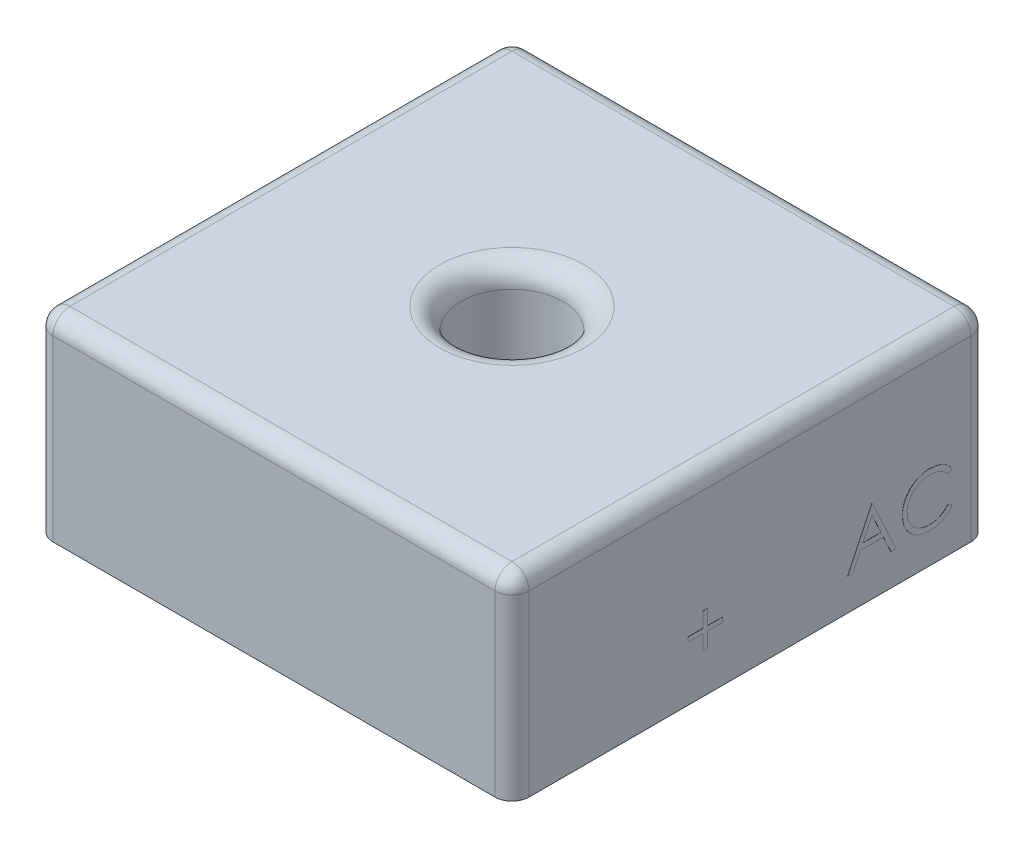
from build123d import *

# Parameters (mm, degrees)
SKETCH1_W                     = 28
SKETCH1_H                     = 28
SKETCH1_R                     = 3
BOSS_EXTRUDE1_DEPTH           = 11.5
FILLET1_R                     = 1.25
SKETCH2_W                     = 25.8
SKETCH2_H                     = 25.8
SKETCH2_R                     = 4
CUT_EXTRUDE1_DEPTH            = 2.5
SKETCH3_R                     = 0.7
BOSS_EXTRUDE2_DEPTH           = 6.5
SKETCH4_R                     = 0.7
BOSS_EXTRUDE3_DEPTH           = 0.5
BOSS_EXTRUDE3_DRAFT           = 20
BOSS_EXTRUDE3_PROFILE_2_DEPTH = 0.5
BOSS_EXTRUDE3_PROFILE_2_DRAFT = 20
BOSS_EXTRUDE3_PROFILE_3_DEPTH = 0.5
BOSS_EXTRUDE3_PROFILE_3_DRAFT = 20
BOSS_EXTRUDE3_PROFILE_4_DEPTH = 0.5
BOSS_EXTRUDE3_PROFILE_4_DRAFT = 20
FILLET2_SIZE                  = 2.2
FILLET3_R                     = 1
BOSS_EXTRUDE4_DEPTH           = 0.01


with BuildPart() as part:
    # Sketch1 → Boss-Extrude1 (new body)
    with BuildSketch(Plane(origin=(0, 0, 0), x_dir=(1, 0, 0), z_dir=(0, 1, 0))):
        Rectangle(SKETCH1_W, SKETCH1_H)
        with Locations(Location((0, 0, 0), (0, 0, 270))):
            Circle(SKETCH1_R, mode=Mode.SUBTRACT)
    extrude(amount=BOSS_EXTRUDE1_DEPTH)

    # Fillet1
    fillet1_edges = [part.edges().sort_by_distance(p)[0] for p in [
        (0, 11.5, -3),
    ]]
    fillet(fillet1_edges, radius=FILLET1_R)

    # Sketch2 → Cut-Extrude1 (cut)
    with BuildSketch(Plane.XZ):
        Rectangle(SKETCH2_W, SKETCH2_H)
        with Locations(Location((0, 0, 0), (0, 0, 270))):
            Circle(SKETCH2_R, mode=Mode.SUBTRACT)
    extrude(amount=-CUT_EXTRUDE1_DEPTH, mode=Mode.SUBTRACT)

    # Sketch3 → Boss-Extrude2 (add)
    with BuildSketch(Plane(origin=(0, 2.5, 0), x_dir=(-1, 0, 0), z_dir=(0, -1, 0))):
        with Locations(Location((-8.9, -2.1, 0), (0, 0, 270))):
            Circle(SKETCH3_R)
        with Locations(Location((-8.9, 8.9, 0), (0, 0, 270))):
            Circle(SKETCH3_R)
        with Locations(Location((8.9, 8.9, 0), (0, 0, 270))):
            Circle(SKETCH3_R)
        with Locations(Location((8.9, -8.9, 0), (0, 0, 270))):
            Circle(SKETCH3_R)
    extrude(amount=BOSS_EXTRUDE2_DEPTH)


with BuildPart() as boss_extrude3_tool:
    # Sketch4 → Boss-Extrude3 (with draft: the straight prism first)
    with BuildSketch(Plane(origin=(0, -4, 0), x_dir=(-1, 0, 0), z_dir=(0, -1, 0))):
        with Locations(Location((8.9, -8.9, 0), (0, 0, 270))):
            Circle(SKETCH4_R)
    extrude(amount=BOSS_EXTRUDE3_DEPTH)
    # Boss-Extrude3: the draft: its side faces are tilted about the plane it starts from
    boss_extrude3_sides = [boss_extrude3_tool.faces().sort_by_distance(p)[0] for p in [
        (-8.9, -4.25, 8.2),
    ]]
    draft(boss_extrude3_sides, Plane(origin=(0, -4, 0), x_dir=(-1, 0, 0), z_dir=(0, -1, 0)), BOSS_EXTRUDE3_DRAFT)


with BuildPart() as part_1:
    add(part.part)

    # Boss-Extrude3: add boss_extrude3_tool
    add(boss_extrude3_tool.part)


with BuildPart() as boss_extrude3_profile_2_tool:
    # Sketch4 → Boss-Extrude3 profile 2 (with draft: the straight prism first)
    with BuildSketch(Plane(origin=(0, -4, 0), x_dir=(-1, 0, 0), z_dir=(0, -1, 0))):
        with Locations(Location((-8.9, -2.1, 0), (0, 0, 270))):
            Circle(SKETCH4_R)
    extrude(amount=BOSS_EXTRUDE3_PROFILE_2_DEPTH)
    # Boss-Extrude3 profile 2: the draft: its side faces are tilted about the plane it starts from
    boss_extrude3_profile_2_sides = [boss_extrude3_profile_2_tool.faces().sort_by_distance(p)[0] for p in [
        (8.9, -4.25, 1.4),
    ]]
    draft(boss_extrude3_profile_2_sides, Plane(origin=(0, -4, 0), x_dir=(-1, 0, 0), z_dir=(0, -1, 0)), BOSS_EXTRUDE3_PROFILE_2_DRAFT)


with BuildPart() as part_2:
    add(part_1.part)

    # Boss-Extrude3 profile 2: add boss_extrude3_profile_2_tool
    add(boss_extrude3_profile_2_tool.part)


with BuildPart() as boss_extrude3_profile_3_tool:
    # Sketch4 → Boss-Extrude3 profile 3 (with draft: the straight prism first)
    with BuildSketch(Plane(origin=(0, -4, 0), x_dir=(-1, 0, 0), z_dir=(0, -1, 0))):
        with Locations(Location((-8.9, 8.9, 0), (0, 0, 270))):
            Circle(SKETCH4_R)
    extrude(amount=BOSS_EXTRUDE3_PROFILE_3_DEPTH)
    # Boss-Extrude3 profile 3: the draft: its side faces are tilted about the plane it starts from
    boss_extrude3_profile_3_sides = [boss_extrude3_profile_3_tool.faces().sort_by_distance(p)[0] for p in [
        (8.9, -4.25, -9.6),
    ]]
    draft(boss_extrude3_profile_3_sides, Plane(origin=(0, -4, 0), x_dir=(-1, 0, 0), z_dir=(0, -1, 0)), BOSS_EXTRUDE3_PROFILE_3_DRAFT)


with BuildPart() as part_3:
    add(part_2.part)

    # Boss-Extrude3 profile 3: add boss_extrude3_profile_3_tool
    add(boss_extrude3_profile_3_tool.part)


with BuildPart() as boss_extrude3_profile_4_tool:
    # Sketch4 → Boss-Extrude3 profile 4 (with draft: the straight prism first)
    with BuildSketch(Plane(origin=(0, -4, 0), x_dir=(-1, 0, 0), z_dir=(0, -1, 0))):
        with Locations(Location((8.9, 8.9, 0), (0, 0, 270))):
            Circle(SKETCH4_R)
    extrude(amount=BOSS_EXTRUDE3_PROFILE_4_DEPTH)
    # Boss-Extrude3 profile 4: the draft: its side faces are tilted about the plane it starts from
    boss_extrude3_profile_4_sides = [boss_extrude3_profile_4_tool.faces().sort_by_distance(p)[0] for p in [
        (-8.9, -4.25, -9.6),
    ]]
    draft(boss_extrude3_profile_4_sides, Plane(origin=(0, -4, 0), x_dir=(-1, 0, 0), z_dir=(0, -1, 0)), BOSS_EXTRUDE3_PROFILE_4_DRAFT)


with BuildPart() as part_4:
    add(part_3.part)

    # Boss-Extrude3 profile 4: add boss_extrude3_profile_4_tool
    add(boss_extrude3_profile_4_tool.part)

    # Fillet2
    # a fillet whose section is not a circle: 2.2 mm, written as the material it adds along each edge
    with BuildSketch(Plane(origin=(12.9, 2.5, -12.9), x_dir=(-1, 0, 0), z_dir=(0, 0, 1)), Plane(origin=(-12.9, 2.5, -12.9), x_dir=(0, 0, 1), z_dir=(1, 0, 0)), Plane(origin=(-12.9, 2.5, 12.9), x_dir=(1, 0, 0), z_dir=(0, 0, -1)), Plane(origin=(12.9, 2.5, 12.9), x_dir=(0, 0, -1), z_dir=(-1, 0, 0))) as fillet2_piece_1:
        with BuildLine():
            Bezier((FILLET2_SIZE, 0), (0, 0), (0, FILLET2_SIZE), weights=[1, 0.25, 1])
            Line((0, FILLET2_SIZE), (0, 0))
            Line((0, 0), (FILLET2_SIZE, 0))
        make_face()
    extrude(amount=25.8)
    with BuildSketch(Plane(origin=(0, 2.5, 0), x_dir=(0, 0, -1), z_dir=(-1, 0, 0))) as fillet2_piece_2:
        with BuildLine():
            Bezier((4, FILLET2_SIZE), (4, 0), (4 + FILLET2_SIZE, 0), weights=[1, 0.25, 1])
            Line((4 + FILLET2_SIZE, 0), (4, 0))
            Line((4, 0), (4, FILLET2_SIZE))
        make_face()
    revolve(axis=Axis((0, 2.5, 0), (0, -1, 0)))
    with BuildSketch(Plane(origin=(8.9, 2.5, 2.1), x_dir=(0, 0, 1), z_dir=(1, 0, 0))) as fillet2_piece_3:
        with BuildLine():
            Bezier((0.7 + FILLET2_SIZE, 0), (0.7, 0), (0.7, FILLET2_SIZE), weights=[1, 0.25, 1])
            Line((0.7, FILLET2_SIZE), (0.7, 0))
            Line((0.7, 0), (0.7 + FILLET2_SIZE, 0))
        make_face()
    revolve(axis=Axis((8.9, 2.5, 2.1), (0, -1, 0)))
    with BuildSketch(Plane(origin=(8.9, 2.5, -8.9), x_dir=(0, 0, 1), z_dir=(1, 0, 0))) as fillet2_piece_4:
        with BuildLine():
            Bezier((0.7 + FILLET2_SIZE, 0), (0.7, 0), (0.7, FILLET2_SIZE), weights=[1, 0.25, 1])
            Line((0.7, FILLET2_SIZE), (0.7, 0))
            Line((0.7, 0), (0.7 + FILLET2_SIZE, 0))
        make_face()
    revolve(axis=Axis((8.9, 2.5, -8.9), (0, -1, 0)))
    with BuildSketch(Plane(origin=(-8.9, 2.5, -8.9), x_dir=(0, 0, 1), z_dir=(1, 0, 0))) as fillet2_piece_5:
        with BuildLine():
            Bezier((0.7 + FILLET2_SIZE, 0), (0.7, 0), (0.7, FILLET2_SIZE), weights=[1, 0.25, 1])
            Line((0.7, FILLET2_SIZE), (0.7, 0))
            Line((0.7, 0), (0.7 + FILLET2_SIZE, 0))
        make_face()
    revolve(axis=Axis((-8.9, 2.5, -8.9), (0, -1, 0)))
    with BuildSketch(Plane(origin=(-8.9, 2.5, 8.9), x_dir=(0, 0, 1), z_dir=(1, 0, 0))) as fillet2_piece_6:
        with BuildLine():
            Bezier((0.7 + FILLET2_SIZE, 0), (0.7, 0), (0.7, FILLET2_SIZE), weights=[1, 0.25, 1])
            Line((0.7, FILLET2_SIZE), (0.7, 0))
            Line((0.7, 0), (0.7 + FILLET2_SIZE, 0))
        make_face()
    revolve(axis=Axis((-8.9, 2.5, 8.9), (0, -1, 0)))

    # Fillet3
    fillet3_edges = [part_4.edges().sort_by_distance(p)[0] for p in [
        (14, 11.5, 0),
        (0, 11.5, -14),
        (-14, 11.5, 0),
        (0, 11.5, 14),
        (-14, 5.75, -14),
        (14, 5.75, -14),
        (14, 5.75, 14),
        (-14, 5.75, 14),
    ]]
    fillet(fillet3_edges, radius=FILLET3_R)

    # Sketch5 → Boss-Extrude4 (add)
    # profile 1 of 3: a face of its own
    with BuildSketch(Plane(origin=(14, 0, 0), x_dir=(0, 0, -1), z_dir=(1, 0, 0))):
        Polygon((-2.768987679, 3.48677818), (-2.768987679, 4.371393565), (-2.49975691, 4.371393565), (-2.49975691, 3.48677818), (-1.615141525, 3.48677818), (-1.615141525, 3.217547411), (-2.49975691, 3.217547411), (-2.49975691, 2.332932026), (-2.768987679, 2.332932026), (-2.768987679, 3.217547411), (-3.653603064, 3.217547411), (-3.653603064, 3.48677818), align=None)
    # profile 2 of 3: a face of its own
    with BuildSketch(Plane(origin=(14, 0, 0), x_dir=(0, 0, -1), z_dir=(1, 0, 0))):
        Polygon((7.192550782, 4.871393565), (8.577166167, 1.871393565), (8.284497898, 1.871393565), (7.840988282, 2.832932026), (6.481012321, 2.832932026), (6.024882513, 1.871393565), (5.731012321, 1.871393565), (7.154089244, 4.871393565), align=None)
        Polygon((7.170315206, 4.286657988), (6.627045975, 3.140624334), (7.699161359, 3.140624334), align=None, mode=Mode.SUBTRACT)
    # profile 3 of 3: a face of its own
    with BuildSketch(Plane(origin=(14, 0, 0), x_dir=(0, 0, -1), z_dir=(1, 0, 0))):
        with BuildLine():
            Line((11.884858475, 4.320912796), (11.649281552, 4.140624334))
            add(Edge.make_bspline(
                [(11.649281552, 4.140624334), (11.632476505, 4.160652308), (11.599092979, 4.200438236), (11.545385091, 4.256306417), (11.489412254, 4.30864807), (11.431195864, 4.357712538), (11.369688048, 4.401784051), (11.306378792, 4.443159282), (11.240209039, 4.480245915), (11.148707552, 4.525214189), (11.029009396, 4.572139464), (10.878328106, 4.611485091), (10.721032878, 4.636531813), (10.61372065, 4.639244535), (10.559137321, 4.640624334)],
                knots=[0, 0, 0, 0, 0.757959112, 1.505699292, 2.245454638, 2.979532153, 3.711538275, 4.438200793, 5.171680507, 5.909471876, 7.393775596, 8.890124382, 10.418191784, 12, 12, 12, 12], degree=3))
            add(Edge.make_bspline(
                [(10.559137321, 4.640624334), (10.529065921, 4.64027808), (10.469202214, 4.639588787), (10.380360665, 4.630495251), (10.29317805, 4.617714214), (10.207711079, 4.598749651), (10.124068543, 4.57477312), (10.041703627, 4.546122766), (9.961808827, 4.51067576), (9.883278908, 4.471497251), (9.808039585, 4.427245156), (9.736849544, 4.378976569), (9.669968428, 4.327231629), (9.607343332, 4.271816395), (9.548910234, 4.212980429), (9.495092539, 4.150096707), (9.446076473, 4.083366273), (9.400890451, 4.013669066), (9.360422394, 3.941208102), (9.32653964, 3.865715185), (9.29653525, 3.788483096), (9.272793042, 3.708639244), (9.254000599, 3.626745445), (9.24103403, 3.542581912), (9.232043912, 3.456324473), (9.231358046, 3.397859348), (9.231012321, 3.368388757)],
                knots=[0, 0, 0, 0, 1.054917814, 2.100044995, 3.131103042, 4.146048494, 5.169673617, 6.183595914, 7.203665975, 8.234915748, 9.262203917, 10.264457458, 11.251630812, 12.227803204, 13.197192746, 14.159520551, 15.12972552, 16.100847026, 17.073214652, 18.039054194, 19.002613845, 19.979014051, 20.95965708, 21.949030935, 22.966165397, 24, 24, 24, 24], degree=3))
            add(Edge.make_bspline(
                [(9.231012321, 3.368388757), (9.23209388, 3.324047626), (9.234217378, 3.236989696), (9.25311595, 3.10947203), (9.2818346, 2.987311452), (9.324876523, 2.871271587), (9.377949995, 2.759921566), (9.445013376, 2.655145406), (9.522684694, 2.555359779), (9.612062768, 2.462922967), (9.710124896, 2.378482631), (9.815337391, 2.30412499), (9.927438209, 2.242140805), (10.045189607, 2.190561422), (10.169497704, 2.150912798), (10.300138964, 2.123000692), (10.436829245, 2.104793109), (10.530231588, 2.103049948), (10.577767129, 2.102162796)],
                knots=[0, 0, 0, 0, 1.029171465, 2.020641659, 2.987623507, 3.938342917, 4.889210282, 5.84687017, 6.821220943, 7.821438502, 8.827599549, 9.822697543, 10.807740252, 11.797342354, 12.80366471, 13.83203677, 14.896651826, 16, 16, 16, 16], degree=3))
            add(Edge.make_bspline(
                [(10.577767129, 2.102162796), (10.630140862, 2.103610321), (10.733224898, 2.106459398), (10.884397492, 2.130595897), (11.029113863, 2.169731255), (11.167381794, 2.224500903), (11.298811491, 2.295699721), (11.423608628, 2.382012187), (11.541878546, 2.48425933), (11.612996788, 2.562330582), (11.649281552, 2.602162796)],
                knots=[0, 0, 0, 0, 1.028121516, 2.023589091, 2.998037872, 3.967518031, 4.937445131, 5.927275754, 6.942489185, 8, 8, 8, 8], degree=3))
            Line((11.649281552, 2.602162796), (11.884858475, 2.423677219))
            add(Edge.make_bspline(
                [(11.884858475, 2.423677219), (11.865900095, 2.399215688), (11.828074145, 2.350409797), (11.766824416, 2.281605475), (11.702301018, 2.21688773), (11.634024695, 2.15677834), (11.562780874, 2.100074513), (11.48729032, 2.048387229), (11.408545435, 2.000995042), (11.326813025, 1.957600535), (11.242179928, 1.919100038), (11.154747555, 1.886139666), (11.064892776, 1.857746903), (10.972611483, 1.8343881), (10.877712263, 1.816155743), (10.780537571, 1.80396745), (10.680877678, 1.795617238), (10.613642174, 1.794856167), (10.579570013, 1.794470488)],
                knots=[0, 0, 0, 0, 0.986787822, 1.968848986, 2.935600012, 3.899624008, 4.868462664, 5.837806735, 6.815139263, 7.798259679, 8.787526145, 9.778297419, 10.776456485, 11.791383307, 12.812564526, 13.85620153, 14.913611965, 16, 16, 16, 16], degree=3))
            add(Edge.make_bspline(
                [(10.579570013, 1.794470488), (10.547304013, 1.794695053), (10.483501993, 1.795139102), (10.389303063, 1.802332389), (10.297597708, 1.812146449), (10.208648029, 1.826923704), (10.121968621, 1.84436171), (10.038345263, 1.867737073), (9.956955083, 1.893922073), (9.878125077, 1.924697776), (9.801788191, 1.959425932), (9.728190638, 1.99867584), (9.657366268, 2.042117438), (9.588618764, 2.088793161), (9.522963693, 2.140202277), (9.459832099, 2.195630821), (9.398869977, 2.254891973), (9.36115339, 2.297624705), (9.342190206, 2.319109911)],
                knots=[0, 0, 0, 0, 1.114604814, 2.203992996, 3.262667896, 4.300477797, 5.318619304, 6.316056647, 7.298880507, 8.271930387, 9.238335007, 10.195173496, 11.151986948, 12.108099108, 13.064862484, 14.031167946, 15.010108607, 16, 16, 16, 16], degree=3))
            add(Edge.make_bspline(
                [(9.342190206, 2.319109911), (9.311816797, 2.35643093), (9.251436674, 2.430622396), (9.174186088, 2.550867523), (9.108059612, 2.676411702), (9.054594537, 2.807914498), (9.012797909, 2.94508083), (8.983842599, 3.087979842), (8.965026938, 3.236478078), (8.962875262, 3.33748104), (8.961781552, 3.388821449)],
                knots=[0, 0, 0, 0, 0.994628077, 1.977248131, 2.950237994, 3.925870899, 4.908910175, 5.911660606, 6.938484602, 8, 8, 8, 8], degree=3))
            add(Edge.make_bspline(
                [(8.961781552, 3.388821449), (8.963114575, 3.442783267), (8.965737214, 3.548949773), (8.988019325, 3.704756019), (9.023864007, 3.854028647), (9.074775626, 3.996488999), (9.13932307, 4.132886382), (9.219060168, 4.262178844), (9.313060575, 4.385193243), (9.420587062, 4.50006303), (9.538501921, 4.605096761), (9.66477519, 4.697502078), (9.799159716, 4.774402806), (9.940175017, 4.838685231), (10.08887703, 4.888094771), (10.244948489, 4.922683217), (10.40809613, 4.944212174), (10.519406781, 4.946933781), (10.575964244, 4.948316642)],
                knots=[0, 0, 0, 0, 1.032925535, 2.032216505, 3.007276963, 3.968222605, 4.92396291, 5.891752235, 6.871517503, 7.883894988, 8.900124299, 9.891468569, 10.874487609, 11.85992873, 12.854644235, 13.869047385, 14.917252991, 16, 16, 16, 16], degree=3))
            add(Edge.make_bspline(
                [(10.575964244, 4.948316642), (10.610433791, 4.94790338), (10.678662789, 4.947085371), (10.779593634, 4.939108678), (10.877858486, 4.925811301), (10.973525042, 4.907711813), (11.067058713, 4.885248394), (11.157744633, 4.855985282), (11.246114936, 4.822525398), (11.331612286, 4.78398957), (11.413826472, 4.740732363), (11.492731888, 4.693233257), (11.567701767, 4.641551138), (11.639263637, 4.586125559), (11.706220389, 4.525783937), (11.770473085, 4.462185997), (11.829839724, 4.393499862), (11.866485319, 4.345152776), (11.884858475, 4.320912796)],
                knots=[0, 0, 0, 0, 1.096760587, 2.17092713, 3.219439832, 4.250915756, 5.268269357, 6.278326846, 7.281116186, 8.274029601, 9.260640565, 10.235837813, 11.203064059, 12.156899882, 13.114053108, 14.069676657, 15.032185724, 16, 16, 16, 16], degree=3))
        make_face()
    extrude(amount=BOSS_EXTRUDE4_DEPTH)


solid = part_4.part
